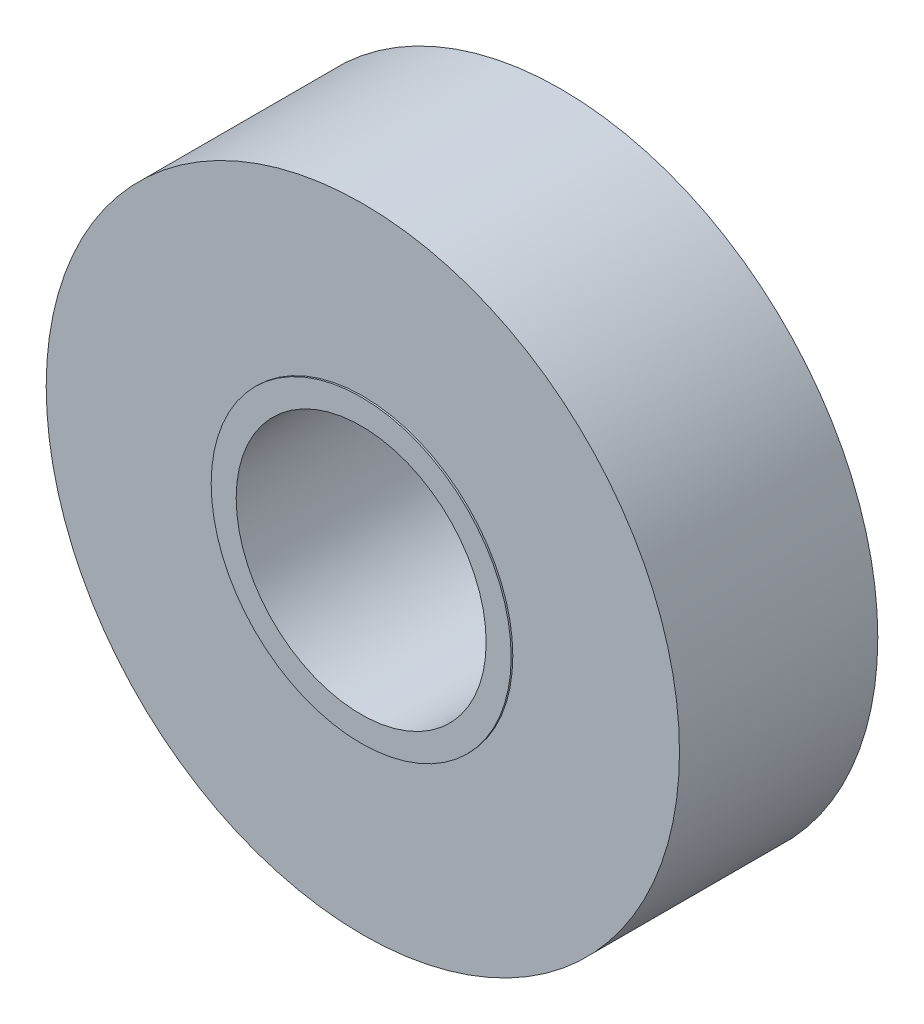
from build123d import *

# Parameters (mm, degrees)
CROQUIS1_R                   = 9
CROQUIS1_R_2                 = 7.5
SALIENTE_EXTRUIR1_DEPTH      = 12
SALIENTE_EXTRUIR2_DEPTH      = 1
SALIENTE_EXTRUIR2_DEPTH_BACK = 0.1
CROQUIS2_R                   = 7.5
CROQUIS3_R                   = 5.2
CROQUIS3_R_2                 = 1.5
SALIENTE_EXTRUIR4_DEPTH      = 3
CROQUIS4_R                   = 19
CROQUIS4_R_2                 = 9
SALIENTE_EXTRUIR5_DEPTH      = 11.9


with BuildPart() as part:
    # Croquis1 → Saliente-Extruir1 (new body)
    with BuildSketch(Plane.XY):
        Circle(CROQUIS1_R)
        Circle(CROQUIS1_R_2, mode=Mode.SUBTRACT)
    extrude(amount=SALIENTE_EXTRUIR1_DEPTH)

    # Croquis2 → Saliente-Extruir2 (add, two sides: drawn at the far end of the back side and taken through both)
    with BuildSketch(Plane.XY.offset(-SALIENTE_EXTRUIR2_DEPTH_BACK)):
        Circle(CROQUIS2_R)
    extrude(amount=SALIENTE_EXTRUIR2_DEPTH + SALIENTE_EXTRUIR2_DEPTH_BACK)

    # Croquis3 → Saliente-Extruir4 (add)
    with BuildSketch(Plane.XY):
        Circle(CROQUIS3_R)
        Circle(CROQUIS3_R_2, mode=Mode.SUBTRACT)
    extrude(amount=-SALIENTE_EXTRUIR4_DEPTH)

    # Croquis4 → Saliente-Extruir5 (add)
    with BuildSketch(Plane(origin=(0, 0, 0), x_dir=(-1, 0, 0), z_dir=(0, 0, -1))):
        Circle(CROQUIS4_R)
        Circle(CROQUIS4_R_2, mode=Mode.SUBTRACT)
    extrude(amount=-SALIENTE_EXTRUIR5_DEPTH)


solid = part.part
